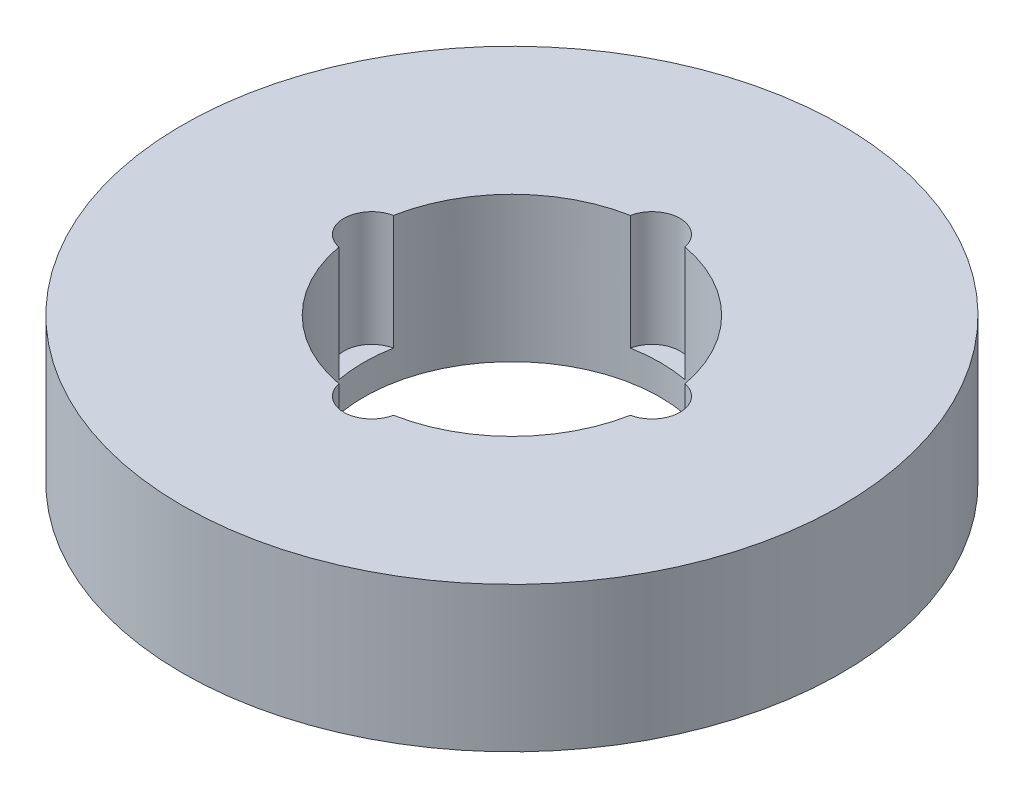
from build123d import *

# Parameters (mm, degrees)
SKETCH1_R           = 50
BOSS_EXTRUDE1_DEPTH = 22
SKETCH2_R           = 22.5
CUT_EXTRUDE1_DEPTH  = 75.054034326
SKETCH3_R           = 4.229056578
CUT_EXTRUDE2_DEPTH  = 17.438124461
CIRPATTERN1_COUNT   = 4


with BuildPart() as part:
    # Sketch1 → Boss-Extrude1 (new body)
    with BuildSketch(Plane(origin=(0, 0, 0), x_dir=(1, 0, 0), z_dir=(0, 1, 0))):
        Circle(SKETCH1_R)
    extrude(amount=BOSS_EXTRUDE1_DEPTH)

    # Sketch2 → Cut-Extrude1 (cut, through all)
    with BuildSketch(Plane(origin=(0, 0, 0), x_dir=(1, 0, 0), z_dir=(0, 1, 0))):
        Circle(SKETCH2_R)
    extrude(amount=CUT_EXTRUDE1_DEPTH, mode=Mode.SUBTRACT)

    # Sketch3 → Cut-Extrude2 (cut)
    with BuildSketch(Plane(origin=(0, 22, 0), x_dir=(1, 0, 0), z_dir=(0, 1, 0))):
        with Locations((-21.263269619, 0)):
            Circle(SKETCH3_R)
    cut_extrude2 = extrude(amount=-CUT_EXTRUDE2_DEPTH, mode=Mode.SUBTRACT)

    # CirPattern1: Cut-Extrude2 ×4 about axis
    cirpattern1_axis = Axis((0, 0, 0), (0, 1, 0))
    for i in range(1, CIRPATTERN1_COUNT):
        add(cut_extrude2.rotate(cirpattern1_axis, i * 360 / CIRPATTERN1_COUNT), mode=Mode.SUBTRACT)


solid = part.part
